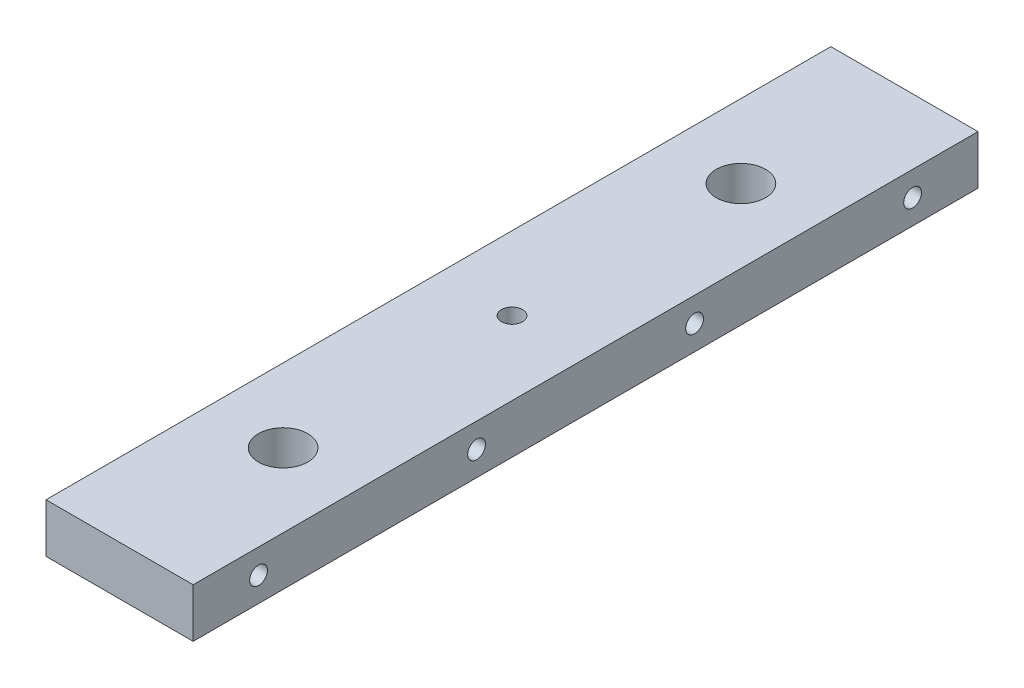
from build123d import *

# Parameters (mm, degrees)
SKETCH2_W           = 28.575
SKETCH2_H           = 152.4
BOSS_EXTRUDE1_DEPTH = 9.525
LPATTERN1_COUNT     = 4
LPATTERN1_PITCH     = 42.333333333
LPATTERN2_COUNT     = 4
LPATTERN2_PITCH     = 42.333333333
SKETCH12_R          = 2.05
SKETCH12_R_2        = 4.7879
CUT_EXTRUDE1_DEPTH  = 156.348048749


with BuildPart() as part:
    # Sketch2 → Boss-Extrude1 (new body)
    with BuildSketch(Plane(origin=(0, 0, 0), x_dir=(1, 0, 0), z_dir=(0, 1, 0))):
        with Locations((14.2875, 76.2)):
            Rectangle(SKETCH2_W, SKETCH2_H)
    extrude(amount=BOSS_EXTRUDE1_DEPTH)

    # Sketch9 → #5 Clearance Hole3 (revolve, cut)
    with BuildSketch(Plane(origin=(0, 4.7625, -139.7), x_dir=(0, 0, 1), z_dir=(0, 1, 0))):
        Polygon((0, 0), (0, 13.737806461), (1.7272, 12.7), (1.7272, 0), align=None)
    f_5_clearance_hole3 = revolve(axis=Axis((-6.35, 4.7625, -139.7), (1, 0, 0)), mode=Mode.SUBTRACT)

    # LPattern1: #5 Clearance Hole3 ×4
    with Locations(*[(0, 0, i * LPATTERN1_PITCH) for i in range(1, LPATTERN1_COUNT)]):
        add(f_5_clearance_hole3, mode=Mode.SUBTRACT)

    # Sketch11 → #5 Clearance Hole4 (revolve, cut)
    with BuildSketch(Plane(origin=(28.575, 4.7625, -12.7), x_dir=(0, 0, -1), z_dir=(0, 1, 0))):
        Polygon((0, 0), (0, 13.737806461), (1.7272, 12.7), (1.7272, 0), align=None)
    f_5_clearance_hole4 = revolve(axis=Axis((34.925, 4.7625, -12.7), (-1, 0, 0)), mode=Mode.SUBTRACT)

    # LPattern2: #5 Clearance Hole4 ×4
    with Locations(*[(0, 0, -i * LPATTERN2_PITCH) for i in range(1, LPATTERN2_COUNT)]):
        add(f_5_clearance_hole4, mode=Mode.SUBTRACT)

    # Sketch12 → Cut-Extrude1 (cut, through all)
    with BuildSketch(Plane(origin=(0, 9.525, 0), x_dir=(1, 0, 0), z_dir=(0, 1, 0))):
        with Locations((14.2875, 76.2)):
            Circle(SKETCH12_R)
        with Locations((14.2875, 31.75)):
            Circle(SKETCH12_R_2)
        with Locations((14.2875, 120.65)):
            Circle(SKETCH12_R_2)
    extrude(amount=-CUT_EXTRUDE1_DEPTH, mode=Mode.SUBTRACT)


solid = part.part
